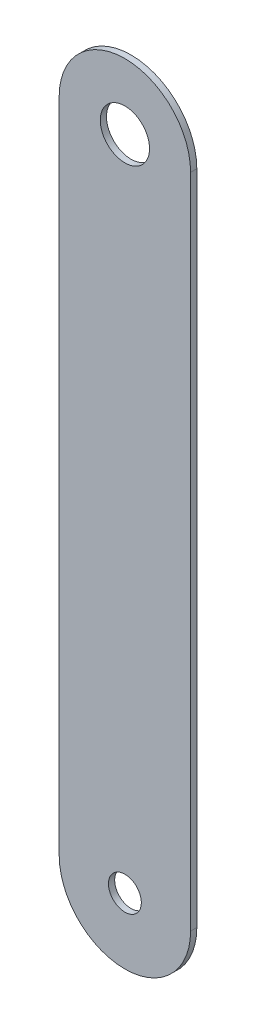
from build123d import *

# Parameters (mm, degrees)
SKETCH1_R           = 4.7625
SKETCH1_R_2         = 3.175
BOSS_EXTRUDE1_DEPTH = 1.2


with BuildPart() as part:
    # Sketch1 → Boss-Extrude1 (new body)
    with BuildSketch(Plane.XY):
        with BuildLine():
            ThreePointArc((12.7, 63.5), (0, 76.2), (-12.7, 63.5))
            Line((-12.7, 63.5), (-12.7, -63.5))
            ThreePointArc((-12.7, -63.5), (0, -76.2), (12.7, -63.5))
            Line((12.7, -63.5), (12.7, 63.5))
        make_face()
        with Locations((0, 63.5)):
            Circle(SKETCH1_R, mode=Mode.SUBTRACT)
        with Locations((0, -63.5)):
            Circle(SKETCH1_R_2, mode=Mode.SUBTRACT)
    extrude(amount=BOSS_EXTRUDE1_DEPTH)


solid = part.part
